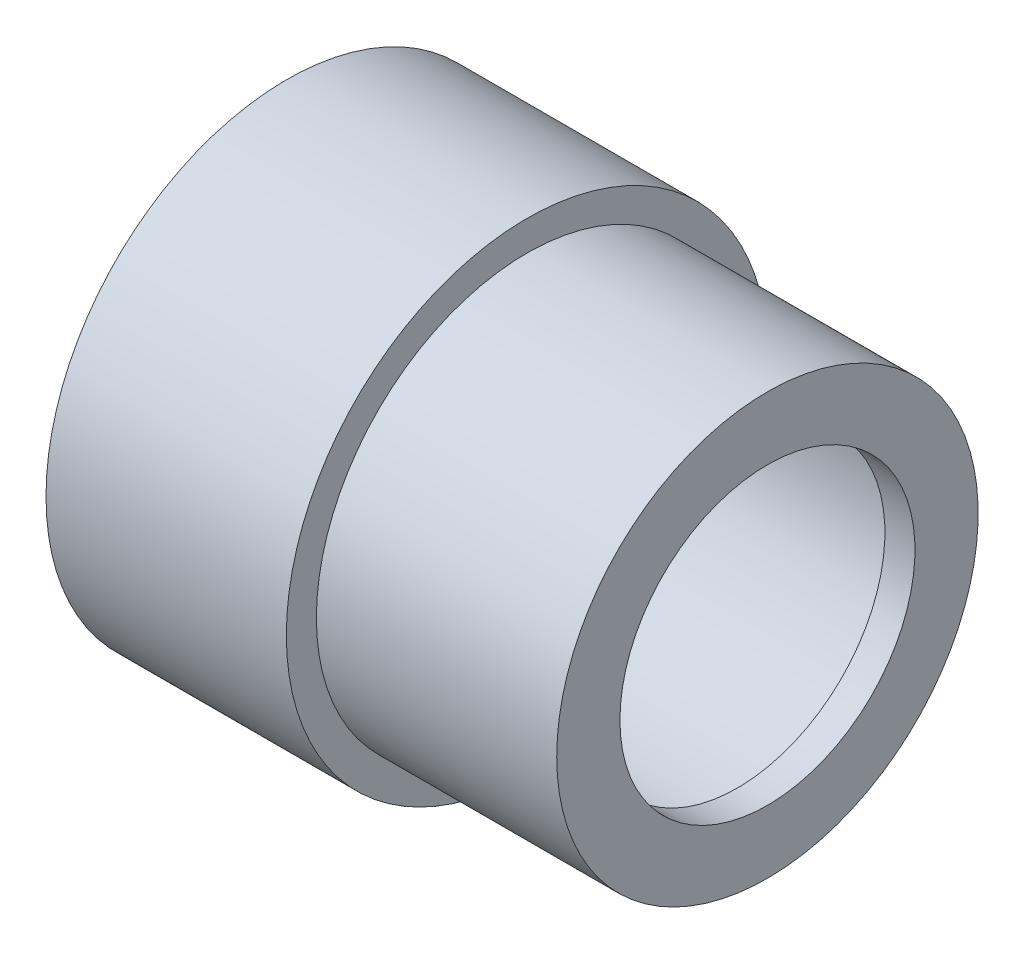
from build123d import *


with BuildPart() as part:
    # Sketch1 → Revolve1 (revolve)
    with BuildSketch(Plane.XY):
        Polygon((0, 89.080500759), (0, 101.780500759), (101.6, 101.780500759), (101.6, 89.080500759), (203.2, 89.080500759), (203.2, 62.361436962), (190.5, 62.361436962), (190.5, 76.380500759), (88.9, 76.380500759), (88.9, 89.080500759), align=None)
    revolve(axis=Axis((0, 0, 0), (1, 0, 0)))


solid = part.part
